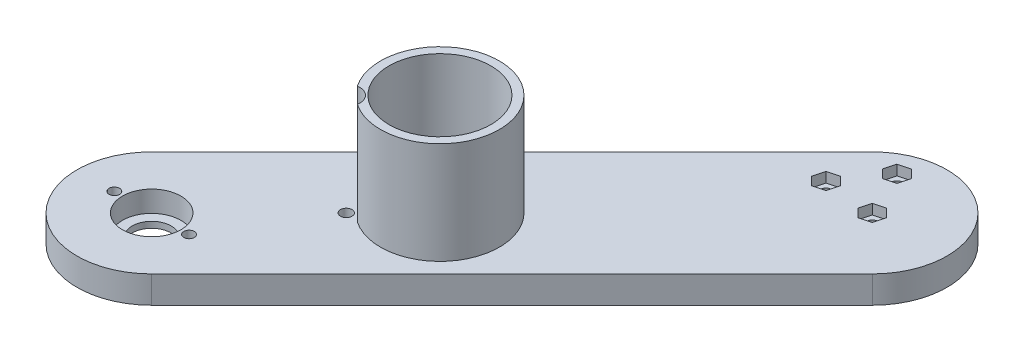
from build123d import *

# Parameters (mm, degrees)
BOSS_EXTRUDE1_DEPTH       = 8
BOSS_EXTRUDE3_START       = 8
SKETCH4_R                 = 15
BOSS_EXTRUDE3_DEPTH       = 30
CUT_EXTRUDE9_DEPTH        = 186.056233377
CUT_EXTRUDE9_DEPTH_BACK   = 186.056233377
SKETCH4_5_R               = 5.75
SKETCH4_5_R_2             = 1.1
SKETCH4_5_R_3             = 1.7
CUT_EXTRUDE5_START        = 8
SKETCH1_8_R               = 1.7
CUT_EXTRUDE5_DEPTH        = 3
CUT_EXTRUDE6_DEPTH        = 3
CUT_EXTRUDE11_START       = 1.8
SKETCH4_7_R               = 8.6
SKETCH4_7_R_2             = 5.75
SKETCH4_7_R_3             = 1.55
CUT_EXTRUDE11_DEPTH       = 6.2
CUT_EXTRUDE13_DEPTH       = 186.056233377
CUT_EXTRUDE13_DEPTH_BACK  = 186.056233377
SKETCH1_10_R              = 1.7
CUT_EXTRUDE14_START       = 2
CUT_EXTRUDE14_OUTLINE_R   = 15
CUT_EXTRUDE14_OUTLINE_R_2 = 1.1
CUT_EXTRUDE14_OUTLINE_R_3 = 5.75
CUT_EXTRUDE14_DEPTH       = 6


# Read off the part's stored shape, not the designer's step: Cut-Extrude14
with BuildPart() as part:
    # Sketch1 → Boss-Extrude1 (new body)
    with BuildSketch(Plane(origin=(0, 0, 0), x_dir=(1, 0, 0), z_dir=(0, 1, 0))):
        with BuildLine():
            Line((-15.556349186, 15.556349186), (90.509667992, 121.622366364))
            ThreePointArc((90.509667992, 121.622366364), (121.622366364, 121.622366364), (121.622366364, 90.509667992))
            Line((121.622366364, 90.509667992), (15.556349186, -15.556349186))
            ThreePointArc((15.556349186, -15.556349186), (-15.556349186, -15.556349186), (-15.556349186, 15.556349186))
        make_face()
    extrude(amount=BOSS_EXTRUDE1_DEPTH)

    # Sketch4 → Boss-Extrude3 (add)
    with BuildSketch(Plane(origin=(0, 0, 0), x_dir=(1, 0, 0), z_dir=(0, 1, 0)).offset(BOSS_EXTRUDE3_START)):
        with BuildLine():
            ThreePointArc((32.579864505, 27.95935453), (50.609789686, 26.957656252), (59.926406871, 42.426406871))
            ThreePointArc((59.926406871, 42.426406871), (37.274873894, 59.150990812), (27.95935453, 32.579864505))
            ThreePointArc((27.95935453, 32.579864505), (31.215238028, 31.696736244), (32.637824638, 28.637824638))
            ThreePointArc((32.637824638, 28.637824638), (32.623308264, 28.297353984), (32.579864505, 27.95935453))
        make_face()
        with Locations(Location((42.426406871, 42.426406871, 0), (0, 0, 270))):
            Circle(SKETCH4_R, mode=Mode.SUBTRACT)
    extrude(amount=BOSS_EXTRUDE3_DEPTH)

    # Sketch4<5> → Cut-Extrude9 (cut, two sides: drawn at the far end of the back side and taken through both)
    with BuildSketch(Plane(origin=(0, 0, 0), x_dir=(1, 0, 0), z_dir=(0, 1, 0)).offset(-CUT_EXTRUDE9_DEPTH_BACK)):
        with Locations(Location((0, 0, 0), (0, 0, 270))):
            Circle(SKETCH4_5_R)
        with Locations(Location((42.426406871, 42.426406871, 0), (0, 0, 270))):
            Circle(SKETCH4_5_R)
        with Locations(Location((42.426406871, 50.426406871, 0), (0, 0, 270))):
            Circle(SKETCH4_5_R_2)
        with Locations(Location((42.426406871, 34.426406871, 0), (0, 0, 270))):
            Circle(SKETCH4_5_R_2)
        with Locations(Location((28.637824638, 28.637824638, 0), (0, 0, 270))):
            Circle(SKETCH4_5_R_3)
    extrude(amount=CUT_EXTRUDE9_DEPTH + CUT_EXTRUDE9_DEPTH_BACK, mode=Mode.SUBTRACT)

    # Sketch1<8> → Cut-Extrude5 (cut)
    # profile 1 of 3: a face of its own
    with BuildSketch(Plane(origin=(0, 0, 0), x_dir=(1, 0, 0), z_dir=(0, 1, 0)).offset(CUT_EXTRUDE5_START)):
        Polygon((102.168353618, 117.21666144), (103.06492909, 120.562726655), (100.615439347, 123.012216398), (97.269374132, 122.115640925), (96.37279866, 118.769575711), (98.822288403, 116.320085968), align=None)
        with Locations(Location((99.718863875, 119.666151183, 0), (0, 0, 270))):
            Circle(SKETCH1_8_R, mode=Mode.SUBTRACT)
    # profile 2 of 3: a face of its own
    with BuildSketch(Plane(origin=(0, 0, 0), x_dir=(1, 0, 0), z_dir=(0, 1, 0)).offset(CUT_EXTRUDE5_START)):
        Polygon((88.665727587, 109.828360261), (87.769152115, 106.482295046), (90.218641857, 104.032805303), (93.564707072, 104.929380776), (94.461282545, 108.275445991), (92.011792802, 110.724935733), align=None)
        with Locations(Location((91.11521733, 107.378870518, 0), (0, 0, 270))):
            Circle(SKETCH1_8_R, mode=Mode.SUBTRACT)
    # profile 3 of 3: a face of its own
    with BuildSketch(Plane(origin=(0, 0, 0), x_dir=(1, 0, 0), z_dir=(0, 1, 0)).offset(CUT_EXTRUDE5_START)):
        Polygon((108.515506921, 103.616527435), (109.412082393, 106.96259265), (106.96259265, 109.412082393), (103.616527435, 108.515506921), (102.719951963, 105.169441706), (105.169441706, 102.719951963), align=None)
        with Locations(Location((106.066017178, 106.066017178, 0), (0, 0, 270))):
            Circle(SKETCH1_8_R, mode=Mode.SUBTRACT)
    extrude(amount=-CUT_EXTRUDE5_DEPTH, mode=Mode.SUBTRACT)

    # Sketch1<9> → Cut-Extrude6 (cut)
    with BuildSketch(Plane(origin=(0, 0, 0), x_dir=(1, 0, 0), z_dir=(0, 1, 0))):
        with BuildLine():
            Line((97.232940058, 93.451075696), (-12.006422067, 169.941300525))
            ThreePointArc((-12.006422067, 169.941300525), (-15.788286429, 191.389319127), (5.659732173, 195.171183489))
            Line((5.659732173, 195.171183489), (114.899094298, 118.68095866))
            ThreePointArc((114.899094298, 118.68095866), (118.68095866, 97.232940058), (97.232940058, 93.451075696))
        make_face()
    extrude(amount=CUT_EXTRUDE6_DEPTH, mode=Mode.SUBTRACT)

    # Sketch4<7> → Cut-Extrude11 (cut)
    # profile 1 of 3: a face of its own
    with BuildSketch(Plane(origin=(0, 0, 0), x_dir=(1, 0, 0), z_dir=(0, 1, 0)).offset(CUT_EXTRUDE11_START)):
        with Locations(Location((0, 0, 0), (0, 0, 270))):
            Circle(SKETCH4_7_R)
        with Locations(Location((0, 0, 0), (0, 0, 270))):
            Circle(SKETCH4_7_R_2, mode=Mode.SUBTRACT)
    # profile 2 of 3: a face of its own
    with BuildSketch(Plane(origin=(0, 0, 0), x_dir=(1, 0, 0), z_dir=(0, 1, 0)).offset(CUT_EXTRUDE11_START)):
        with Locations(Location((11, 0, 0), (0, 0, 270))):
            Circle(SKETCH4_7_R_3)
    # profile 3 of 3: a face of its own
    with BuildSketch(Plane(origin=(0, 0, 0), x_dir=(1, 0, 0), z_dir=(0, 1, 0)).offset(CUT_EXTRUDE11_START)):
        with Locations(Location((-11, 0, 0), (0, 0, 270))):
            Circle(SKETCH4_7_R_3)
    extrude(amount=CUT_EXTRUDE11_DEPTH, mode=Mode.SUBTRACT)

    # Sketch1<10> → Cut-Extrude13 (cut, two sides: drawn at the far end of the back side and taken through both)
    with BuildSketch(Plane(origin=(0, 0, 0), x_dir=(1, 0, 0), z_dir=(0, 1, 0)).offset(-CUT_EXTRUDE13_DEPTH_BACK)):
        with Locations(Location((99.718863875, 119.666151183, 0), (0, 0, 90))):
            Circle(SKETCH1_10_R)
        with Locations(Location((91.11521733, 107.378870518, 0), (0, 0, 90))):
            Circle(SKETCH1_10_R)
        with Locations(Location((106.066017178, 106.066017178, 0), (0, 0, 90))):
            Circle(SKETCH1_10_R)
    extrude(amount=CUT_EXTRUDE13_DEPTH + CUT_EXTRUDE13_DEPTH_BACK, mode=Mode.SUBTRACT)

    # Cut-Extrude14 outline → Cut-Extrude14 (cut)
    with BuildSketch(Plane(origin=(0, 0, 0), x_dir=(1, 0, 0), z_dir=(0, 1, 0)).offset(CUT_EXTRUDE14_START)):
        with Locations((42.426406871, 42.426406871)):
            Circle(CUT_EXTRUDE14_OUTLINE_R)
        with Locations((42.426406871, 34.426406871)):
            Circle(CUT_EXTRUDE14_OUTLINE_R_2, mode=Mode.SUBTRACT)
        with Locations((42.426406871, 42.426406871)):
            Circle(CUT_EXTRUDE14_OUTLINE_R_3, mode=Mode.SUBTRACT)
        with Locations((42.426406871, 50.426406871)):
            Circle(CUT_EXTRUDE14_OUTLINE_R_2, mode=Mode.SUBTRACT)
    extrude(amount=CUT_EXTRUDE14_DEPTH, mode=Mode.SUBTRACT)


solid = part.part
